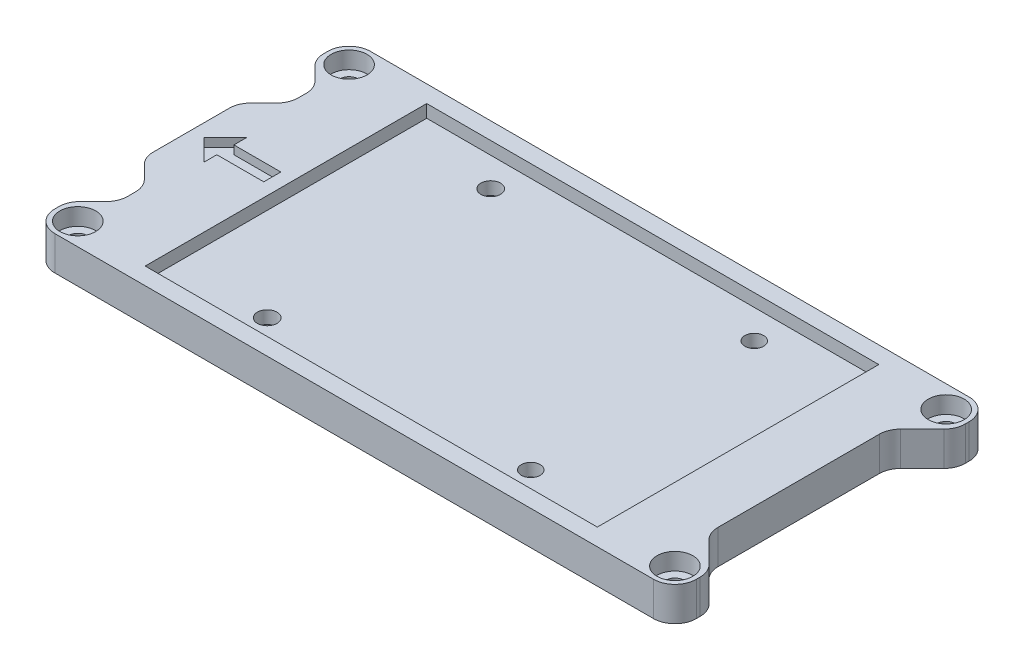
from build123d import *

# Parameters (mm, degrees)
SZKIC1_W                    = 75.2
SZKIC1_H                    = 37
DODANIE_WYCI_GNI_CIE1_DEPTH = 4
SZKIC2_W                    = 53
SZKIC2_H                    = 33
WYTNIJ_WYCI_GNI_CIE1_DEPTH  = 1.5
SZKIC4_R                    = 1.1
WYTNIJ_WYCI_GNI_CIE2_DEPTH  = 43.095249138
SZKIC8_R                    = 2.1
WYTNIJ_WYCI_GNI_CIE5_DEPTH  = 2
LUSTRO2_COPY_1_SKETCH_R     = 1.1
LUSTRO2_COPY_1_DEPTH        = 43.095249138
LUSTRO2_COPY_2_SKETCH_R     = 2.1
LUSTRO2_COPY_2_DEPTH        = 2
LUSTRO2_COPY_3_SKETCH_R     = 1.1
LUSTRO2_COPY_3_DEPTH        = 43.095249138
LUSTRO2_COPY_4_SKETCH_R     = 2.1
LUSTRO2_COPY_4_DEPTH        = 2
ZAOKR_GLENIE1_R             = 2.5
SZKIC6_R                    = 1.15
SZKIC6_R_2                  = 1.1
WYTNIJ_WYCI_GNI_CIE3_DEPTH  = 42.979280604
SZKIC11_R                   = 2.1
WYTNIJ_WYCI_GNI_CIE8_DEPTH  = 1
WYTNIJ_WYCI_GNI_CIE4_DEPTH  = 1
WYTNIJ_WYCI_GNI_CIE6_DEPTH  = 43.095249138
ZAOKR_GLENIE2_R             = 2.5
ZAOKR_GLENIE2_OF_LUSTRO4_R  = 2.5
WYTNIJ_WYCI_GNI_CIE7_DEPTH  = 43.095249138
ZAOKR_GLENIE3_R             = 2.5


with BuildPart() as part:
    # Szkic1 → Dodanie-wyciągnięcie1 (new body)
    with BuildSketch(Plane(origin=(0, 0, 0), x_dir=(1, 0, 0), z_dir=(0, 1, 0))):
        Rectangle(SZKIC1_W, SZKIC1_H)
    extrude(amount=DODANIE_WYCI_GNI_CIE1_DEPTH)

    # Szkic2 → Wytnij-wyciągnięcie1 (cut)
    with BuildSketch(Plane(origin=(0, 4, 0), x_dir=(1, 0, 0), z_dir=(0, 1, 0))):
        Rectangle(SZKIC2_W, SZKIC2_H)
    extrude(amount=-WYTNIJ_WYCI_GNI_CIE1_DEPTH, mode=Mode.SUBTRACT)

    # Szkic4 → Wytnij-wyciągnięcie2 (cut, through all)
    with BuildSketch(Plane(origin=(0, 4, 0), x_dir=(1, 0, 0), z_dir=(0, 1, 0))):
        with Locations((-35, 15.9)):
            Circle(SZKIC4_R)
    wytnij_wyci_gni_cie2 = extrude(amount=-WYTNIJ_WYCI_GNI_CIE2_DEPTH, mode=Mode.SUBTRACT)

    # Szkic8 → Wytnij-wyciągnięcie5 (cut)
    with BuildSketch(Plane(origin=(0, 4, 0), x_dir=(1, 0, 0), z_dir=(0, 1, 0))):
        with Locations((-35, 15.9)):
            Circle(SZKIC8_R)
    wytnij_wyci_gni_cie5 = extrude(amount=-WYTNIJ_WYCI_GNI_CIE5_DEPTH, mode=Mode.SUBTRACT)

    # Lustro1: Wytnij-wyciągnięcie2, Wytnij-wyciągnięcie5 across plane
    add(wytnij_wyci_gni_cie2.mirror(Plane.XY), mode=Mode.SUBTRACT)
    add(wytnij_wyci_gni_cie5.mirror(Plane.XY), mode=Mode.SUBTRACT)

    # Lustro2 copy 1 sketch → Lustro2 copy 1 (cut, through all)
    with BuildSketch(Plane(origin=(0, 4, 0), x_dir=(-1, 0, 0), z_dir=(0, 1, 0))):
        with Locations((-35, 15.9)):
            Circle(LUSTRO2_COPY_1_SKETCH_R)
    extrude(amount=-LUSTRO2_COPY_1_DEPTH, mode=Mode.SUBTRACT)

    # Lustro2 copy 2 sketch → Lustro2 copy 2 (cut)
    with BuildSketch(Plane(origin=(0, 4, 0), x_dir=(-1, 0, 0), z_dir=(0, 1, 0))):
        with Locations((-35, 15.9)):
            Circle(LUSTRO2_COPY_2_SKETCH_R)
    extrude(amount=-LUSTRO2_COPY_2_DEPTH, mode=Mode.SUBTRACT)

    # Lustro2 copy 3 sketch → Lustro2 copy 3 (cut, through all)
    with BuildSketch(Plane(origin=(0, 4, 0), x_dir=(-1, 0, 0), z_dir=(0, 1, 0))):
        with Locations((-35, -15.9)):
            Circle(LUSTRO2_COPY_3_SKETCH_R)
    extrude(amount=-LUSTRO2_COPY_3_DEPTH, mode=Mode.SUBTRACT)

    # Lustro2 copy 4 sketch → Lustro2 copy 4 (cut)
    with BuildSketch(Plane(origin=(0, 4, 0), x_dir=(-1, 0, 0), z_dir=(0, 1, 0))):
        with Locations((-35, -15.9)):
            Circle(LUSTRO2_COPY_4_SKETCH_R)
    extrude(amount=-LUSTRO2_COPY_4_DEPTH, mode=Mode.SUBTRACT)

    # Zaokrąglenie1
    zaokr_glenie1_edges = [part.edges().sort_by_distance(p)[0] for p in [
        (-37.6, 2, 18.5),
        (-37.6, 2, -18.5),
        (37.6, 2, -18.5),
        (37.6, 2, 18.5),
    ]]
    fillet(zaokr_glenie1_edges, radius=ZAOKR_GLENIE1_R)

    # Szkic6 → Wytnij-wyciągnięcie3 (cut, through all)
    with BuildSketch(Plane(origin=(0, 2.5, 0), x_dir=(1, 0, 0), z_dir=(0, 1, 0))):
        with Locations((-15.6, -13.1)):
            Circle(SZKIC6_R)
        with Locations((15.3, -13.1)):
            Circle(SZKIC6_R_2)
    wytnij_wyci_gni_cie3 = extrude(amount=-WYTNIJ_WYCI_GNI_CIE3_DEPTH, mode=Mode.SUBTRACT)

    # Szkic11 → Wytnij-wyciągnięcie8 (cut)
    with BuildSketch(Plane.XZ):
        with Locations((15.3, 13.1)):
            Circle(SZKIC11_R)
        with Locations((-15.6, 13.1)):
            Circle(SZKIC11_R)
    wytnij_wyci_gni_cie8 = extrude(amount=-WYTNIJ_WYCI_GNI_CIE8_DEPTH, mode=Mode.SUBTRACT)

    # Lustro3: Wytnij-wyciągnięcie3, Wytnij-wyciągnięcie8 across plane
    add(wytnij_wyci_gni_cie3.mirror(Plane.XY), mode=Mode.SUBTRACT)
    add(wytnij_wyci_gni_cie8.mirror(Plane.XY), mode=Mode.SUBTRACT)

    # Szkic7 → Wytnij-wyciągnięcie4 (cut)
    with BuildSketch(Plane(origin=(0, 4, 0), x_dir=(1, 0, 0), z_dir=(0, 1, 0))):
        Polygon((-36.1, 0), (-33.6, 2.5), (-33.6, 1), (-28.1, 1), (-28.1, -1), (-33.6, -1), (-33.6, -2.5), align=None)
    extrude(amount=-WYTNIJ_WYCI_GNI_CIE4_DEPTH, mode=Mode.SUBTRACT)

    # Szkic9 → Wytnij-wyciągnięcie6 (cut, through all)
    with BuildSketch(Plane(origin=(0, 4, 0), x_dir=(1, 0, 0), z_dir=(0, 1, 0))):
        Polygon((-37.6, 14.5), (-34.6, 11.5), (-34.6, 8.5), (-37.6, 5.5), align=None)
    wytnij_wyci_gni_cie6 = extrude(amount=-WYTNIJ_WYCI_GNI_CIE6_DEPTH, mode=Mode.SUBTRACT)

    # Zaokrąglenie2
    zaokr_glenie2_edges = [part.edges().sort_by_distance(p)[0] for p in [
        (-37.6, 2, -5.5),
        (-34.6, 2, -8.5),
        (-34.6, 2, -11.5),
        (-37.6, 2, -14.5),
    ]]
    fillet(zaokr_glenie2_edges, radius=ZAOKR_GLENIE2_R)

    # Lustro4: Wytnij-wyciągnięcie6 across plane
    add(wytnij_wyci_gni_cie6.mirror(Plane.XY), mode=Mode.SUBTRACT)

    # Zaokrąglenie2 of Lustro4
    zaokr_glenie2_of_lustro4_edges = [part.edges().sort_by_distance(p)[0] for p in [
        (-37.6, 2, 5.5),
        (-34.6, 2, 8.5),
        (-34.6, 2, 11.5),
        (-37.6, 2, 14.5),
    ]]
    fillet(zaokr_glenie2_of_lustro4_edges, radius=ZAOKR_GLENIE2_OF_LUSTRO4_R)

    # Szkic10 → Wytnij-wyciągnięcie7 (cut, through all)
    with BuildSketch(Plane(origin=(0, 4, 0), x_dir=(1, 0, 0), z_dir=(0, 1, 0))):
        Polygon((37.6, 14.5), (33.6, 10.5), (33.6, -10.5), (37.6, -14.5), align=None)
    extrude(amount=-WYTNIJ_WYCI_GNI_CIE7_DEPTH, mode=Mode.SUBTRACT)

    # Zaokrąglenie3
    zaokr_glenie3_edges = [part.edges().sort_by_distance(p)[0] for p in [
        (37.6, 2, 14.5),
        (33.6, 2, 10.5),
        (33.6, 2, -10.5),
        (37.6, 2, -14.5),
    ]]
    fillet(zaokr_glenie3_edges, radius=ZAOKR_GLENIE3_R)


solid = part.part
